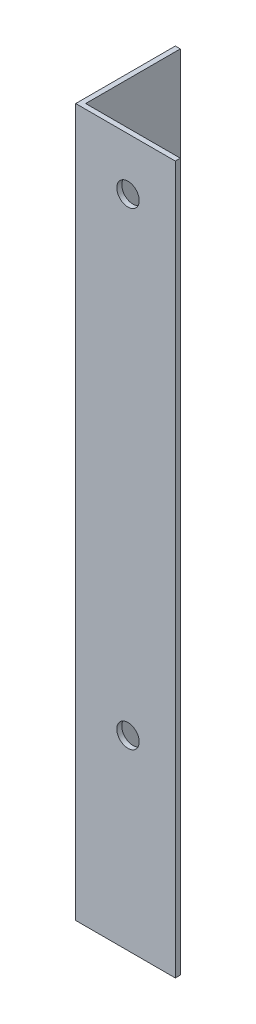
from build123d import *

# Parameters (mm, degrees)
EXTRUDE_1_DEPTH     = 142
SKETCH_2_R          = 2.25
CUT_EXTRUDE_1_DEPTH = 145.654761415
SKETCH_3_R          = 2.25
CUT_EXTRUDE_2_DEPTH = 145.789502382


with BuildPart() as part:
    # Эскиз1 → Бобышка-Вытянуть1 (new body)
    with BuildSketch(Plane(origin=(0, 0, 0), x_dir=(1, 0, 0), z_dir=(0, 1, 0))):
        Polygon((0, 0), (0, 20), (1, 20), (1, 1), (20, 1), (20, 0), align=None)
    extrude(amount=EXTRUDE_1_DEPTH)

    # Эскиз2 → Вырез-Вытянуть1 (cut, through all)
    with BuildSketch(Plane(origin=(0, 0, -1), x_dir=(-1, 0, 0), z_dir=(0, 0, -1))):
        with Locations((-10.5, 131.5)):
            Circle(SKETCH_2_R)
    extrude(amount=-CUT_EXTRUDE_1_DEPTH, mode=Mode.SUBTRACT)

    # Эскиз3 → Вырез-Вытянуть2 (cut, through all)
    with BuildSketch(Plane.XY):
        with Locations((10.5, 37.411219035)):
            Circle(SKETCH_3_R)
    extrude(amount=-CUT_EXTRUDE_2_DEPTH, mode=Mode.SUBTRACT)


solid = part.part
